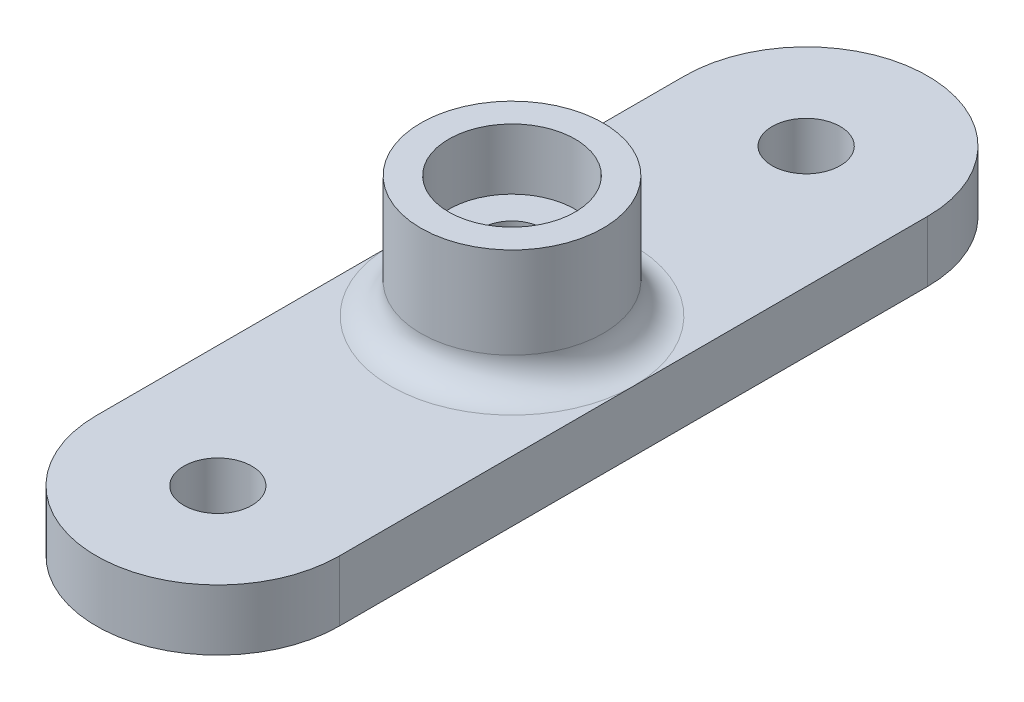
from build123d import *

# Parameters (mm, degrees)
SKETCH1_R           = 1.778
SKETCH1_R_2         = 1.5875
BOSS_EXTRUDE1_DEPTH = 3.175
SKETCH2_R           = 4.7625
SKETCH2_R_2         = 1.5875
BOSS_EXTRUDE2_DEPTH = 6.35
SKETCH3_R           = 3.302
CUT_EXTRUDE1_DEPTH  = 3.175
FILLET1_R           = 1.5875


with BuildPart() as part:
    # Sketch1 → Boss-Extrude1 (new body)
    with BuildSketch(Plane(origin=(0, 0, 0), x_dir=(1, 0, 0), z_dir=(0, 1, 0))):
        with BuildLine():
            Line((6.35, 15.367), (6.35, -15.367))
            ThreePointArc((6.35, -15.367), (0, -21.717), (-6.35, -15.367))
            Line((-6.35, -15.367), (-6.35, 15.367))
            ThreePointArc((-6.35, 15.367), (0, 21.717), (6.35, 15.367))
        make_face()
        with Locations(Location((0, 15.367, 0), (0, 0, 270))):
            Circle(SKETCH1_R, mode=Mode.SUBTRACT)
        with Locations(Location((0, -15.367, 0), (0, 0, 270))):
            Circle(SKETCH1_R, mode=Mode.SUBTRACT)
        with Locations(Location((0, 0, 0), (0, 0, 270))):
            Circle(SKETCH1_R_2, mode=Mode.SUBTRACT)
    extrude(amount=BOSS_EXTRUDE1_DEPTH)

    # Sketch2 → Boss-Extrude2 (add)
    with BuildSketch(Plane(origin=(0, 3.175, 0), x_dir=(1, 0, 0), z_dir=(0, 1, 0))):
        with Locations(Location((0, 0, 0), (0, 0, 270))):
            Circle(SKETCH2_R)
        with Locations(Location((0, 0, 0), (0, 0, 270))):
            Circle(SKETCH2_R_2, mode=Mode.SUBTRACT)
    extrude(amount=BOSS_EXTRUDE2_DEPTH)

    # Sketch3 → Cut-Extrude1 (cut)
    with BuildSketch(Plane(origin=(0, 9.525, 0), x_dir=(1, 0, 0), z_dir=(0, 1, 0))):
        with Locations(Location((0, 0, 0), (0, 0, 270))):
            Circle(SKETCH3_R)
    extrude(amount=-CUT_EXTRUDE1_DEPTH, mode=Mode.SUBTRACT)

    # Fillet1
    fillet1_edges = [part.edges().sort_by_distance(p)[0] for p in [
        (0, 3.175, -4.7625),
    ]]
    fillet(fillet1_edges, radius=FILLET1_R - 0.0001)  # a hair under: the kernel refuses the full size


solid = part.part
